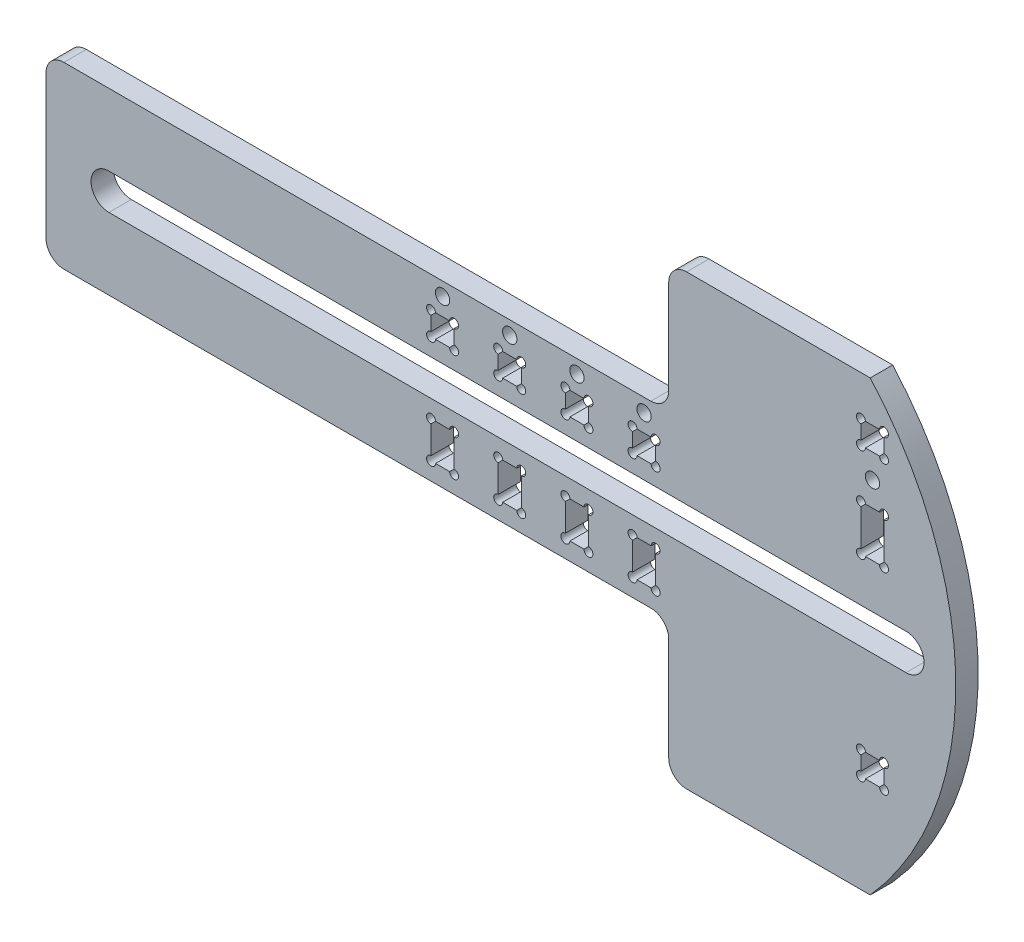
from build123d import *

# Parameters (mm, degrees)
ESBO_O1_R             = 1.5
ESBO_O1_R_2           = 1.500000022
ESBO_O1_W             = 5.15
ESBO_O1_H             = 5.150000119
ESBO_O1_H_2           = 10.15
ESBO_O1_H_3           = 8.150000119
ESBO_O1_H_4           = 5.15
FLANGE_BASE1_DEPTH    = 5
ESBO_O2_R             = 1
CORTE_EXTRUS_O1_DEPTH = 5
CORTE_EXTRUS_O2_REACH = 125.402
ESBO_O3_R             = 1.6


# Sheet-metal steps are written as plain solids
with BuildPart() as part:
    # Esboço1 → Flange-base1 (new body)
    with BuildSketch(Plane.XY):
        with BuildLine():
            Line((42.906488073, -57.24787756), (42.906488073, -34.258558753))
            ThreePointArc((42.906488073, -34.258558753), (41.734915199, -31.430131624), (38.906488072, -30.258558747))
            Line((38.906488072, -30.258558747), (-92.146640805, -30.258558747))
            ThreePointArc((-92.146640805, -30.258558747), (-94.975067929, -29.086985872), (-96.146640805, -26.258558747))
            Line((-96.146640805, -26.258558747), (-96.146640805, 5.752123418))
            ThreePointArc((-96.146640805, 5.752123418), (-94.975067929, 8.580550543), (-92.146640805, 9.752123418))
            Line((-92.146640805, 9.752123418), (38.906488017, 9.752123418))
            ThreePointArc((38.906488017, 9.752123418), (41.73491514, 10.923696291), (42.906488017, 13.752123413))
            Line((42.906488017, 13.752123413), (42.906488017, 34.752123929))
            ThreePointArc((42.906488017, 34.752123929), (44.078060914, 37.58055107), (46.906488073, 38.752123924))
            Line((46.906488073, 38.752123924), (87.906488738, 38.752123924))
            ThreePointArc((87.906488738, 38.752123924), (107.013267009, -11.247876821), (87.906488738, -61.247877566))
            Line((87.906488738, -61.247877566), (46.906488073, -61.247877566))
            ThreePointArc((46.906488073, -61.247877566), (44.078060946, -60.076304689), (42.906488073, -57.24787756))
        make_face()
        with Locations((37.406487746, 6.752123154)):
            Circle(ESBO_O1_R, mode=Mode.SUBTRACT)
        with Locations((88.406488193, 19.252123619)):
            Circle(ESBO_O1_R_2, mode=Mode.SUBTRACT)
        with Locations((22.406487746, 6.752123154)):
            Circle(ESBO_O1_R, mode=Mode.SUBTRACT)
        with Locations((7.406487746, 6.752123154)):
            Circle(ESBO_O1_R, mode=Mode.SUBTRACT)
        with Locations((-7.593512254, 6.752123154)):
            Circle(ESBO_O1_R, mode=Mode.SUBTRACT)
        with BuildLine():
            Line((-82.091601362, -6.247877277), (95.906488231, -6.247877277))
            ThreePointArc((95.906488231, -6.247877277), (99.906488003, -10.247877049), (95.906488231, -14.247876821))
            Line((95.906488231, -14.247876821), (-82.093511769, -14.247876821))
            ThreePointArc((-82.093511769, -14.247876821), (-86.093511655, -10.246921617), (-82.091601362, -6.247877277))
        make_face(mode=Mode.SUBTRACT)
        with Locations((37.406490824, 0.252123359)):
            Rectangle(ESBO_O1_W, ESBO_O1_H, mode=Mode.SUBTRACT)
        with Locations((88.406490824, 8.752123299)):
            Rectangle(ESBO_O1_W, ESBO_O1_H_2, mode=Mode.SUBTRACT)
        with Locations((88.406490824, -36.747877)):
            Rectangle(ESBO_O1_W, ESBO_O1_H, mode=Mode.SUBTRACT)
        with Locations((37.406490824, -22.247877)):
            Rectangle(ESBO_O1_W, ESBO_O1_H_3, mode=Mode.SUBTRACT)
        with Locations((88.406490824, 27.252123537)):
            Rectangle(ESBO_O1_W, ESBO_O1_H_4, mode=Mode.SUBTRACT)
        with Locations((22.406490824, 0.252123359)):
            Rectangle(ESBO_O1_W, ESBO_O1_H, mode=Mode.SUBTRACT)
        with Locations((22.406490824, -22.247877)):
            Rectangle(ESBO_O1_W, ESBO_O1_H_3, mode=Mode.SUBTRACT)
        with Locations((7.406490824, 0.252123359)):
            Rectangle(ESBO_O1_W, ESBO_O1_H, mode=Mode.SUBTRACT)
        with Locations((7.406490824, -22.247877)):
            Rectangle(ESBO_O1_W, ESBO_O1_H_3, mode=Mode.SUBTRACT)
        with Locations((-7.593509176, 0.252123359)):
            Rectangle(ESBO_O1_W, ESBO_O1_H, mode=Mode.SUBTRACT)
        with Locations((-7.593509176, -22.247877)):
            Rectangle(ESBO_O1_W, ESBO_O1_H_3, mode=Mode.SUBTRACT)
    extrude(amount=-FLANGE_BASE1_DEPTH)

    # Esboço2 → Corte-extrusão1 (cut)
    with BuildSketch(Plane.XY):
        with Locations((90.981490824, 29.827123537)):
            Circle(ESBO_O2_R)
        with Locations((85.831490824, 29.827123537)):
            Circle(ESBO_O2_R)
        with Locations((85.831490824, 24.677123537)):
            Circle(ESBO_O2_R)
        with Locations((90.981490824, 24.677123537)):
            Circle(ESBO_O2_R)
        with Locations((90.981490824, 13.827123299)):
            Circle(ESBO_O2_R)
        with Locations((85.831490824, 13.827123299)):
            Circle(ESBO_O2_R)
        with Locations((90.981490824, 3.677123299)):
            Circle(ESBO_O2_R)
        with Locations((85.831490824, 3.677123299)):
            Circle(ESBO_O2_R)
        with Locations((85.831490824, -34.17287694)):
            Circle(ESBO_O2_R)
        with Locations((90.981490824, -34.17287694)):
            Circle(ESBO_O2_R)
        with Locations((90.981490824, -39.322877059)):
            Circle(ESBO_O2_R)
        with Locations((85.831490824, -39.322877059)):
            Circle(ESBO_O2_R)
        with Locations((34.831490824, 2.827123418)):
            Circle(ESBO_O2_R)
        with Locations((39.981490824, 2.827123418)):
            Circle(ESBO_O2_R)
        with Locations((39.981490824, -2.322876701)):
            Circle(ESBO_O2_R)
        with Locations((34.831490824, -2.322876701)):
            Circle(ESBO_O2_R)
        with Locations((34.831490824, -18.17287694)):
            Circle(ESBO_O2_R)
        with Locations((39.981490824, -18.17287694)):
            Circle(ESBO_O2_R)
        with Locations((39.981490824, -26.322877059)):
            Circle(ESBO_O2_R)
        with Locations((34.831490824, -26.322877059)):
            Circle(ESBO_O2_R)
        with Locations((19.831490824, 2.827123418)):
            Circle(ESBO_O2_R)
        with Locations((24.981490824, 2.827123418)):
            Circle(ESBO_O2_R)
        with Locations((24.981490824, -2.322876701)):
            Circle(ESBO_O2_R)
        with Locations((19.831490824, -2.322876701)):
            Circle(ESBO_O2_R)
        with Locations((19.831490824, -18.17287694)):
            Circle(ESBO_O2_R)
        with Locations((24.981490824, -18.17287694)):
            Circle(ESBO_O2_R)
        with Locations((24.981490824, -26.322877059)):
            Circle(ESBO_O2_R)
        with Locations((19.831490824, -26.322877059)):
            Circle(ESBO_O2_R)
        with Locations((4.831490824, 2.827123418)):
            Circle(ESBO_O2_R)
        with Locations((9.981490824, 2.827123418)):
            Circle(ESBO_O2_R)
        with Locations((9.981490824, -2.322876701)):
            Circle(ESBO_O2_R)
        with Locations((4.831490824, -2.322876701)):
            Circle(ESBO_O2_R)
        with Locations((4.831490824, -18.17287694)):
            Circle(ESBO_O2_R)
        with Locations((9.981490824, -18.17287694)):
            Circle(ESBO_O2_R)
        with Locations((9.981490824, -26.322877059)):
            Circle(ESBO_O2_R)
        with Locations((4.831490824, -26.322877059)):
            Circle(ESBO_O2_R)
        with Locations((-10.168509176, 2.827123418)):
            Circle(ESBO_O2_R)
        with Locations((-5.018509176, 2.827123418)):
            Circle(ESBO_O2_R)
        with Locations((-5.018509176, -2.322876701)):
            Circle(ESBO_O2_R)
        with Locations((-10.168509176, -2.322876701)):
            Circle(ESBO_O2_R)
        with Locations((-10.168509176, -18.17287694)):
            Circle(ESBO_O2_R)
        with Locations((-5.018509176, -18.17287694)):
            Circle(ESBO_O2_R)
        with Locations((-5.018509176, -26.322877059)):
            Circle(ESBO_O2_R)
        with Locations((-10.168509176, -26.322877059)):
            Circle(ESBO_O2_R)
    extrude(amount=-CORTE_EXTRUS_O1_DEPTH, mode=Mode.SUBTRACT)

    # Esboço3 → Corte-extrusão2 (cut, up to next)
    with BuildSketch(Plane.XY, mode=Mode.PRIVATE) as corte_extrus_o2_sk1:
        with Locations((88.406488193, 19.252123619)):
            Circle(ESBO_O3_R)
    corte_extrus_o2_tool1 = extrude(corte_extrus_o2_sk1.sketch, amount=-CORTE_EXTRUS_O2_REACH, mode=Mode.PRIVATE) & part.part
    # Esboço3 → Corte-extrusão2 (cut, up to next)
    with BuildSketch(Plane.XY, mode=Mode.PRIVATE) as corte_extrus_o2_sk2:
        with Locations((37.406487746, 6.752123154)):
            Circle(ESBO_O3_R)
    corte_extrus_o2_tool2 = extrude(corte_extrus_o2_sk2.sketch, amount=-CORTE_EXTRUS_O2_REACH, mode=Mode.PRIVATE) & part.part
    # Esboço3 → Corte-extrusão2 (cut, up to next)
    with BuildSketch(Plane.XY, mode=Mode.PRIVATE) as corte_extrus_o2_sk3:
        with Locations((22.406487746, 6.752123154)):
            Circle(ESBO_O3_R)
    corte_extrus_o2_tool3 = extrude(corte_extrus_o2_sk3.sketch, amount=-CORTE_EXTRUS_O2_REACH, mode=Mode.PRIVATE) & part.part
    # Esboço3 → Corte-extrusão2 (cut, up to next)
    with BuildSketch(Plane.XY, mode=Mode.PRIVATE) as corte_extrus_o2_sk4:
        with Locations((7.406487746, 6.752123154)):
            Circle(ESBO_O3_R)
    corte_extrus_o2_tool4 = extrude(corte_extrus_o2_sk4.sketch, amount=-CORTE_EXTRUS_O2_REACH, mode=Mode.PRIVATE) & part.part
    # Esboço3 → Corte-extrusão2 (cut, up to next)
    with BuildSketch(Plane.XY, mode=Mode.PRIVATE) as corte_extrus_o2_sk5:
        with Locations((-7.593512254, 6.752123154)):
            Circle(ESBO_O3_R)
    corte_extrus_o2_tool5 = extrude(corte_extrus_o2_sk5.sketch, amount=-CORTE_EXTRUS_O2_REACH, mode=Mode.PRIVATE) & part.part
    add(corte_extrus_o2_tool1.solids().sort_by_distance((88.406488, 19.252124, 0))[0], mode=Mode.SUBTRACT)
    add(corte_extrus_o2_tool2.solids().sort_by_distance((37.406488, 6.752123, 0))[0], mode=Mode.SUBTRACT)
    add(corte_extrus_o2_tool3.solids().sort_by_distance((22.406488, 6.752123, 0))[0], mode=Mode.SUBTRACT)
    add(corte_extrus_o2_tool4.solids().sort_by_distance((7.406488, 6.752123, 0))[0], mode=Mode.SUBTRACT)
    add(corte_extrus_o2_tool5.solids().sort_by_distance((-7.593512, 6.752123, 0))[0], mode=Mode.SUBTRACT)


solid = part.part
